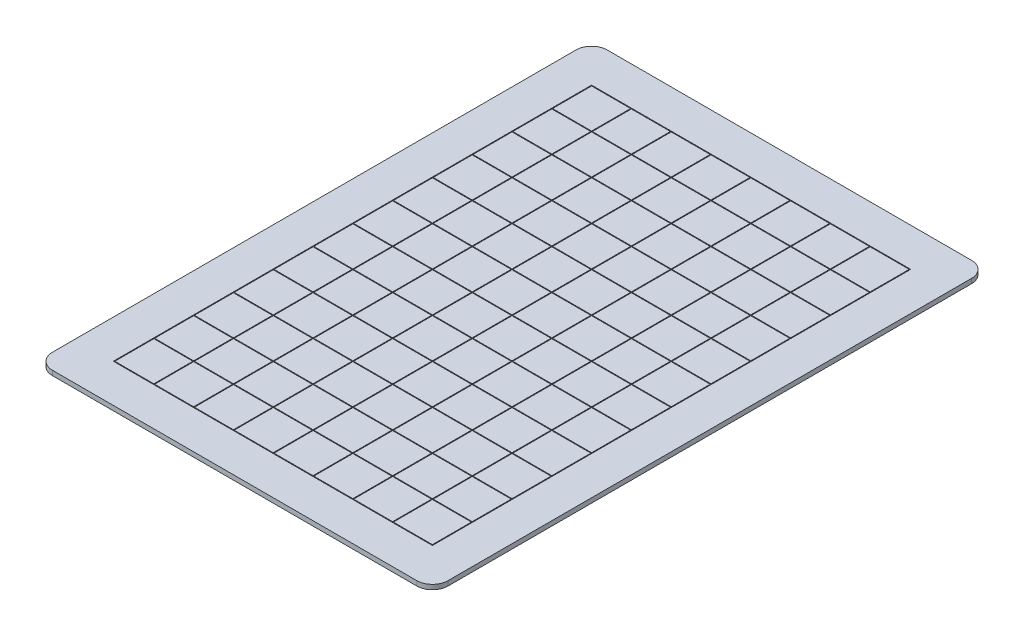
from build123d import *

# Parameters (mm, degrees)
SKETCH1_W           = 253.5
SKETCH1_H           = 355.5
BOSS_EXTRUDE1_DEPTH = 3
SKETCH2_W           = 204.5
SKETCH2_H           = 306.5
SKETCH2_W_2         = 25
SKETCH2_H_2         = 25
CUT_EXTRUDE1_DEPTH  = 0.5
SKETCH4_R           = 1.6
CUT_EXTRUDE2_DEPTH  = 1.2
FILLET1_R           = 10
SKETCH5_W           = 5
SKETCH5_H           = 4
SKETCH5_H_2         = 4.38
CUT_EXTRUDE3_DEPTH  = 2
SKETCH5_3_W         = 5
SKETCH5_3_H         = 4
SKETCH5_3_H_2       = 4.38
CUT_EXTRUDE4_DEPTH  = 2


with BuildPart() as part:
    # Sketch1 → Boss-Extrude1 (new body)
    with BuildSketch(Plane(origin=(0, 0, 0), x_dir=(1, 0, 0), z_dir=(0, 1, 0))):
        with Locations((126.75, 177.75)):
            Rectangle(SKETCH1_W, SKETCH1_H)
    extrude(amount=BOSS_EXTRUDE1_DEPTH)

    # Sketch2 → Cut-Extrude1 (cut)
    with BuildSketch(Plane(origin=(0, 3, 0), x_dir=(1, 0, 0), z_dir=(0, 1, 0))):
        with Locations((126.75, 177.75)):
            Rectangle(SKETCH2_W, SKETCH2_H)
        with Locations((37.5, 37.5)):
            Rectangle(SKETCH2_W_2, SKETCH2_H_2, mode=Mode.SUBTRACT)
        with Locations((63, 37.5)):
            Rectangle(SKETCH2_W_2, SKETCH2_H_2, mode=Mode.SUBTRACT)
        with Locations((88.5, 37.5)):
            Rectangle(SKETCH2_W_2, SKETCH2_H_2, mode=Mode.SUBTRACT)
        with Locations((114, 37.5)):
            Rectangle(SKETCH2_W_2, SKETCH2_H_2, mode=Mode.SUBTRACT)
        with Locations((139.5, 37.5)):
            Rectangle(SKETCH2_W_2, SKETCH2_H_2, mode=Mode.SUBTRACT)
        with Locations((165, 37.5)):
            Rectangle(SKETCH2_W_2, SKETCH2_H_2, mode=Mode.SUBTRACT)
        with Locations((190.5, 37.5)):
            Rectangle(SKETCH2_W_2, SKETCH2_H_2, mode=Mode.SUBTRACT)
        with Locations((216, 37.5)):
            Rectangle(SKETCH2_W_2, SKETCH2_H_2, mode=Mode.SUBTRACT)
        with Locations((63, 63)):
            Rectangle(SKETCH2_W_2, SKETCH2_H_2, mode=Mode.SUBTRACT)
        with Locations((88.5, 63)):
            Rectangle(SKETCH2_W_2, SKETCH2_H_2, mode=Mode.SUBTRACT)
        with Locations((114, 63)):
            Rectangle(SKETCH2_W_2, SKETCH2_H_2, mode=Mode.SUBTRACT)
        with Locations((139.5, 63)):
            Rectangle(SKETCH2_W_2, SKETCH2_H_2, mode=Mode.SUBTRACT)
        with Locations((165, 63)):
            Rectangle(SKETCH2_W_2, SKETCH2_H_2, mode=Mode.SUBTRACT)
        with Locations((190.5, 63)):
            Rectangle(SKETCH2_W_2, SKETCH2_H_2, mode=Mode.SUBTRACT)
        with Locations((216, 63)):
            Rectangle(SKETCH2_W_2, SKETCH2_H_2, mode=Mode.SUBTRACT)
        with Locations((63, 88.5)):
            Rectangle(SKETCH2_W_2, SKETCH2_H_2, mode=Mode.SUBTRACT)
        with Locations((88.5, 88.5)):
            Rectangle(SKETCH2_W_2, SKETCH2_H_2, mode=Mode.SUBTRACT)
        with Locations((114, 88.5)):
            Rectangle(SKETCH2_W_2, SKETCH2_H_2, mode=Mode.SUBTRACT)
        with Locations((139.5, 88.5)):
            Rectangle(SKETCH2_W_2, SKETCH2_H_2, mode=Mode.SUBTRACT)
        with Locations((165, 88.5)):
            Rectangle(SKETCH2_W_2, SKETCH2_H_2, mode=Mode.SUBTRACT)
        with Locations((190.5, 88.5)):
            Rectangle(SKETCH2_W_2, SKETCH2_H_2, mode=Mode.SUBTRACT)
        with Locations((216, 88.5)):
            Rectangle(SKETCH2_W_2, SKETCH2_H_2, mode=Mode.SUBTRACT)
        with Locations((63, 114)):
            Rectangle(SKETCH2_W_2, SKETCH2_H_2, mode=Mode.SUBTRACT)
        with Locations((88.5, 114)):
            Rectangle(SKETCH2_W_2, SKETCH2_H_2, mode=Mode.SUBTRACT)
        with Locations((114, 114)):
            Rectangle(SKETCH2_W_2, SKETCH2_H_2, mode=Mode.SUBTRACT)
        with Locations((139.5, 114)):
            Rectangle(SKETCH2_W_2, SKETCH2_H_2, mode=Mode.SUBTRACT)
        with Locations((165, 114)):
            Rectangle(SKETCH2_W_2, SKETCH2_H_2, mode=Mode.SUBTRACT)
        with Locations((190.5, 114)):
            Rectangle(SKETCH2_W_2, SKETCH2_H_2, mode=Mode.SUBTRACT)
        with Locations((216, 114)):
            Rectangle(SKETCH2_W_2, SKETCH2_H_2, mode=Mode.SUBTRACT)
        with Locations((63, 139.5)):
            Rectangle(SKETCH2_W_2, SKETCH2_H_2, mode=Mode.SUBTRACT)
        with Locations((88.5, 139.5)):
            Rectangle(SKETCH2_W_2, SKETCH2_H_2, mode=Mode.SUBTRACT)
        with Locations((114, 139.5)):
            Rectangle(SKETCH2_W_2, SKETCH2_H_2, mode=Mode.SUBTRACT)
        with Locations((139.5, 139.5)):
            Rectangle(SKETCH2_W_2, SKETCH2_H_2, mode=Mode.SUBTRACT)
        with Locations((165, 139.5)):
            Rectangle(SKETCH2_W_2, SKETCH2_H_2, mode=Mode.SUBTRACT)
        with Locations((190.5, 139.5)):
            Rectangle(SKETCH2_W_2, SKETCH2_H_2, mode=Mode.SUBTRACT)
        with Locations((216, 139.5)):
            Rectangle(SKETCH2_W_2, SKETCH2_H_2, mode=Mode.SUBTRACT)
        with Locations((63, 165)):
            Rectangle(SKETCH2_W_2, SKETCH2_H_2, mode=Mode.SUBTRACT)
        with Locations((88.5, 165)):
            Rectangle(SKETCH2_W_2, SKETCH2_H_2, mode=Mode.SUBTRACT)
        with Locations((114, 165)):
            Rectangle(SKETCH2_W_2, SKETCH2_H_2, mode=Mode.SUBTRACT)
        with Locations((139.5, 165)):
            Rectangle(SKETCH2_W_2, SKETCH2_H_2, mode=Mode.SUBTRACT)
        with Locations((165, 165)):
            Rectangle(SKETCH2_W_2, SKETCH2_H_2, mode=Mode.SUBTRACT)
        with Locations((190.5, 165)):
            Rectangle(SKETCH2_W_2, SKETCH2_H_2, mode=Mode.SUBTRACT)
        with Locations((216, 165)):
            Rectangle(SKETCH2_W_2, SKETCH2_H_2, mode=Mode.SUBTRACT)
        with Locations((63, 190.5)):
            Rectangle(SKETCH2_W_2, SKETCH2_H_2, mode=Mode.SUBTRACT)
        with Locations((88.5, 190.5)):
            Rectangle(SKETCH2_W_2, SKETCH2_H_2, mode=Mode.SUBTRACT)
        with Locations((114, 190.5)):
            Rectangle(SKETCH2_W_2, SKETCH2_H_2, mode=Mode.SUBTRACT)
        with Locations((139.5, 190.5)):
            Rectangle(SKETCH2_W_2, SKETCH2_H_2, mode=Mode.SUBTRACT)
        with Locations((165, 190.5)):
            Rectangle(SKETCH2_W_2, SKETCH2_H_2, mode=Mode.SUBTRACT)
        with Locations((190.5, 190.5)):
            Rectangle(SKETCH2_W_2, SKETCH2_H_2, mode=Mode.SUBTRACT)
        with Locations((216, 190.5)):
            Rectangle(SKETCH2_W_2, SKETCH2_H_2, mode=Mode.SUBTRACT)
        with Locations((63, 216)):
            Rectangle(SKETCH2_W_2, SKETCH2_H_2, mode=Mode.SUBTRACT)
        with Locations((88.5, 216)):
            Rectangle(SKETCH2_W_2, SKETCH2_H_2, mode=Mode.SUBTRACT)
        with Locations((114, 216)):
            Rectangle(SKETCH2_W_2, SKETCH2_H_2, mode=Mode.SUBTRACT)
        with Locations((139.5, 216)):
            Rectangle(SKETCH2_W_2, SKETCH2_H_2, mode=Mode.SUBTRACT)
        with Locations((165, 216)):
            Rectangle(SKETCH2_W_2, SKETCH2_H_2, mode=Mode.SUBTRACT)
        with Locations((190.5, 216)):
            Rectangle(SKETCH2_W_2, SKETCH2_H_2, mode=Mode.SUBTRACT)
        with Locations((216, 216)):
            Rectangle(SKETCH2_W_2, SKETCH2_H_2, mode=Mode.SUBTRACT)
        with Locations((63, 241.5)):
            Rectangle(SKETCH2_W_2, SKETCH2_H_2, mode=Mode.SUBTRACT)
        with Locations((88.5, 241.5)):
            Rectangle(SKETCH2_W_2, SKETCH2_H_2, mode=Mode.SUBTRACT)
        with Locations((114, 241.5)):
            Rectangle(SKETCH2_W_2, SKETCH2_H_2, mode=Mode.SUBTRACT)
        with Locations((139.5, 241.5)):
            Rectangle(SKETCH2_W_2, SKETCH2_H_2, mode=Mode.SUBTRACT)
        with Locations((165, 241.5)):
            Rectangle(SKETCH2_W_2, SKETCH2_H_2, mode=Mode.SUBTRACT)
        with Locations((190.5, 241.5)):
            Rectangle(SKETCH2_W_2, SKETCH2_H_2, mode=Mode.SUBTRACT)
        with Locations((216, 241.5)):
            Rectangle(SKETCH2_W_2, SKETCH2_H_2, mode=Mode.SUBTRACT)
        with Locations((63, 267)):
            Rectangle(SKETCH2_W_2, SKETCH2_H_2, mode=Mode.SUBTRACT)
        with Locations((88.5, 267)):
            Rectangle(SKETCH2_W_2, SKETCH2_H_2, mode=Mode.SUBTRACT)
        with Locations((114, 267)):
            Rectangle(SKETCH2_W_2, SKETCH2_H_2, mode=Mode.SUBTRACT)
        with Locations((139.5, 267)):
            Rectangle(SKETCH2_W_2, SKETCH2_H_2, mode=Mode.SUBTRACT)
        with Locations((165, 267)):
            Rectangle(SKETCH2_W_2, SKETCH2_H_2, mode=Mode.SUBTRACT)
        with Locations((190.5, 267)):
            Rectangle(SKETCH2_W_2, SKETCH2_H_2, mode=Mode.SUBTRACT)
        with Locations((216, 267)):
            Rectangle(SKETCH2_W_2, SKETCH2_H_2, mode=Mode.SUBTRACT)
        with Locations((63, 292.5)):
            Rectangle(SKETCH2_W_2, SKETCH2_H_2, mode=Mode.SUBTRACT)
        with Locations((88.5, 292.5)):
            Rectangle(SKETCH2_W_2, SKETCH2_H_2, mode=Mode.SUBTRACT)
        with Locations((114, 292.5)):
            Rectangle(SKETCH2_W_2, SKETCH2_H_2, mode=Mode.SUBTRACT)
        with Locations((139.5, 292.5)):
            Rectangle(SKETCH2_W_2, SKETCH2_H_2, mode=Mode.SUBTRACT)
        with Locations((165, 292.5)):
            Rectangle(SKETCH2_W_2, SKETCH2_H_2, mode=Mode.SUBTRACT)
        with Locations((190.5, 292.5)):
            Rectangle(SKETCH2_W_2, SKETCH2_H_2, mode=Mode.SUBTRACT)
        with Locations((216, 292.5)):
            Rectangle(SKETCH2_W_2, SKETCH2_H_2, mode=Mode.SUBTRACT)
        with Locations((63, 318)):
            Rectangle(SKETCH2_W_2, SKETCH2_H_2, mode=Mode.SUBTRACT)
        with Locations((88.5, 318)):
            Rectangle(SKETCH2_W_2, SKETCH2_H_2, mode=Mode.SUBTRACT)
        with Locations((114, 318)):
            Rectangle(SKETCH2_W_2, SKETCH2_H_2, mode=Mode.SUBTRACT)
        with Locations((139.5, 318)):
            Rectangle(SKETCH2_W_2, SKETCH2_H_2, mode=Mode.SUBTRACT)
        with Locations((165, 318)):
            Rectangle(SKETCH2_W_2, SKETCH2_H_2, mode=Mode.SUBTRACT)
        with Locations((190.5, 318)):
            Rectangle(SKETCH2_W_2, SKETCH2_H_2, mode=Mode.SUBTRACT)
        with Locations((216, 318)):
            Rectangle(SKETCH2_W_2, SKETCH2_H_2, mode=Mode.SUBTRACT)
        with Locations((37.5, 63)):
            Rectangle(SKETCH2_W_2, SKETCH2_H_2, mode=Mode.SUBTRACT)
        with Locations((37.5, 88.5)):
            Rectangle(SKETCH2_W_2, SKETCH2_H_2, mode=Mode.SUBTRACT)
        with Locations((37.5, 114)):
            Rectangle(SKETCH2_W_2, SKETCH2_H_2, mode=Mode.SUBTRACT)
        with Locations((37.5, 139.5)):
            Rectangle(SKETCH2_W_2, SKETCH2_H_2, mode=Mode.SUBTRACT)
        with Locations((37.5, 165)):
            Rectangle(SKETCH2_W_2, SKETCH2_H_2, mode=Mode.SUBTRACT)
        with Locations((37.5, 190.5)):
            Rectangle(SKETCH2_W_2, SKETCH2_H_2, mode=Mode.SUBTRACT)
        with Locations((37.5, 216)):
            Rectangle(SKETCH2_W_2, SKETCH2_H_2, mode=Mode.SUBTRACT)
        with Locations((37.5, 241.5)):
            Rectangle(SKETCH2_W_2, SKETCH2_H_2, mode=Mode.SUBTRACT)
        with Locations((37.5, 267)):
            Rectangle(SKETCH2_W_2, SKETCH2_H_2, mode=Mode.SUBTRACT)
        with Locations((37.5, 292.5)):
            Rectangle(SKETCH2_W_2, SKETCH2_H_2, mode=Mode.SUBTRACT)
        with Locations((37.5, 318)):
            Rectangle(SKETCH2_W_2, SKETCH2_H_2, mode=Mode.SUBTRACT)
    extrude(amount=-CUT_EXTRUDE1_DEPTH, mode=Mode.SUBTRACT)

    # Sketch4 → Cut-Extrude2 (cut)
    with BuildSketch(Plane.XZ):
        with Locations((6, -177.75)):
            Circle(SKETCH4_R)
        with Locations((247.5, -177.75)):
            Circle(SKETCH4_R)
        with Locations((6, -6)):
            Circle(SKETCH4_R)
        with Locations((6, -91.875)):
            Circle(SKETCH4_R)
        with Locations((6, -263.625)):
            Circle(SKETCH4_R)
        with Locations((6, -349.5)):
            Circle(SKETCH4_R)
        with Locations((247.5, -6)):
            Circle(SKETCH4_R)
        with Locations((247.5, -91.875)):
            Circle(SKETCH4_R)
        with Locations((247.5, -263.625)):
            Circle(SKETCH4_R)
        with Locations((86.5, -349.5)):
            Circle(SKETCH4_R)
        with Locations((167, -349.5)):
            Circle(SKETCH4_R)
        with Locations((247.5, -349.5)):
            Circle(SKETCH4_R)
        with Locations((167, -6)):
            Circle(SKETCH4_R)
        with Locations((86.5, -6)):
            Circle(SKETCH4_R)
    extrude(amount=-CUT_EXTRUDE2_DEPTH, mode=Mode.SUBTRACT)

    # Fillet1
    fillet1_edges = [part.edges().sort_by_distance(p)[0] for p in [
        (253.5, 1.5, 0),
        (0, 1.5, 0),
        (0, 1.5, -355.5),
        (253.5, 1.5, -355.5),
    ]]
    fillet(fillet1_edges, radius=FILLET1_R)

    # Sketch5 → Cut-Extrude3 (cut)
    with BuildSketch(Plane.XZ):
        with Locations((190.5, -241.5)):
            Rectangle(SKETCH5_W, SKETCH5_H)
        with Locations((190.5, -247.69)):
            Rectangle(SKETCH5_W, SKETCH5_H_2)
        with Locations((190.5, -216)):
            Rectangle(SKETCH5_W, SKETCH5_H)
        with Locations((190.5, -222.19)):
            Rectangle(SKETCH5_W, SKETCH5_H_2)
        with Locations((165, -216)):
            Rectangle(SKETCH5_W, SKETCH5_H)
        with Locations((165, -222.19)):
            Rectangle(SKETCH5_W, SKETCH5_H_2)
        with Locations((139.5, -216)):
            Rectangle(SKETCH5_W, SKETCH5_H)
        with Locations((139.5, -222.19)):
            Rectangle(SKETCH5_W, SKETCH5_H_2)
        with Locations((114, -216)):
            Rectangle(SKETCH5_W, SKETCH5_H)
        with Locations((114, -222.19)):
            Rectangle(SKETCH5_W, SKETCH5_H_2)
        with Locations((88.5, -216)):
            Rectangle(SKETCH5_W, SKETCH5_H)
        with Locations((88.5, -222.19)):
            Rectangle(SKETCH5_W, SKETCH5_H_2)
        with Locations((63, -216)):
            Rectangle(SKETCH5_W, SKETCH5_H)
        with Locations((63, -222.19)):
            Rectangle(SKETCH5_W, SKETCH5_H_2)
        with Locations((37.5, -216)):
            Rectangle(SKETCH5_W, SKETCH5_H)
        with Locations((37.5, -222.19)):
            Rectangle(SKETCH5_W, SKETCH5_H_2)
        with Locations((190.5, -190.5)):
            Rectangle(SKETCH5_W, SKETCH5_H)
        with Locations((190.5, -196.69)):
            Rectangle(SKETCH5_W, SKETCH5_H_2)
        with Locations((165, -190.5)):
            Rectangle(SKETCH5_W, SKETCH5_H)
        with Locations((165, -196.69)):
            Rectangle(SKETCH5_W, SKETCH5_H_2)
        with Locations((139.5, -190.5)):
            Rectangle(SKETCH5_W, SKETCH5_H)
        with Locations((139.5, -196.69)):
            Rectangle(SKETCH5_W, SKETCH5_H_2)
        with Locations((114, -190.5)):
            Rectangle(SKETCH5_W, SKETCH5_H)
        with Locations((114, -196.69)):
            Rectangle(SKETCH5_W, SKETCH5_H_2)
        with Locations((88.5, -190.5)):
            Rectangle(SKETCH5_W, SKETCH5_H)
        with Locations((88.5, -196.69)):
            Rectangle(SKETCH5_W, SKETCH5_H_2)
        with Locations((63, -190.5)):
            Rectangle(SKETCH5_W, SKETCH5_H)
        with Locations((63, -196.69)):
            Rectangle(SKETCH5_W, SKETCH5_H_2)
        with Locations((37.5, -190.5)):
            Rectangle(SKETCH5_W, SKETCH5_H)
        with Locations((37.5, -196.69)):
            Rectangle(SKETCH5_W, SKETCH5_H_2)
        with Locations((190.5, -165)):
            Rectangle(SKETCH5_W, SKETCH5_H)
        with Locations((190.5, -171.19)):
            Rectangle(SKETCH5_W, SKETCH5_H_2)
        with Locations((165, -165)):
            Rectangle(SKETCH5_W, SKETCH5_H)
        with Locations((165, -171.19)):
            Rectangle(SKETCH5_W, SKETCH5_H_2)
        with Locations((139.5, -165)):
            Rectangle(SKETCH5_W, SKETCH5_H)
        with Locations((139.5, -171.19)):
            Rectangle(SKETCH5_W, SKETCH5_H_2)
        with Locations((114, -165)):
            Rectangle(SKETCH5_W, SKETCH5_H)
        with Locations((114, -171.19)):
            Rectangle(SKETCH5_W, SKETCH5_H_2)
        with Locations((88.5, -165)):
            Rectangle(SKETCH5_W, SKETCH5_H)
        with Locations((88.5, -171.19)):
            Rectangle(SKETCH5_W, SKETCH5_H_2)
        with Locations((63, -165)):
            Rectangle(SKETCH5_W, SKETCH5_H)
        with Locations((63, -171.19)):
            Rectangle(SKETCH5_W, SKETCH5_H_2)
        with Locations((37.5, -165)):
            Rectangle(SKETCH5_W, SKETCH5_H)
        with Locations((37.5, -171.19)):
            Rectangle(SKETCH5_W, SKETCH5_H_2)
        with Locations((190.5, -139.5)):
            Rectangle(SKETCH5_W, SKETCH5_H)
        with Locations((190.5, -145.69)):
            Rectangle(SKETCH5_W, SKETCH5_H_2)
        with Locations((165, -139.5)):
            Rectangle(SKETCH5_W, SKETCH5_H)
        with Locations((165, -145.69)):
            Rectangle(SKETCH5_W, SKETCH5_H_2)
        with Locations((139.5, -139.5)):
            Rectangle(SKETCH5_W, SKETCH5_H)
        with Locations((139.5, -145.69)):
            Rectangle(SKETCH5_W, SKETCH5_H_2)
        with Locations((114, -139.5)):
            Rectangle(SKETCH5_W, SKETCH5_H)
        with Locations((114, -145.69)):
            Rectangle(SKETCH5_W, SKETCH5_H_2)
        with Locations((88.5, -139.5)):
            Rectangle(SKETCH5_W, SKETCH5_H)
        with Locations((88.5, -145.69)):
            Rectangle(SKETCH5_W, SKETCH5_H_2)
        with Locations((63, -139.5)):
            Rectangle(SKETCH5_W, SKETCH5_H)
        with Locations((63, -145.69)):
            Rectangle(SKETCH5_W, SKETCH5_H_2)
        with Locations((37.5, -139.5)):
            Rectangle(SKETCH5_W, SKETCH5_H)
        with Locations((37.5, -145.69)):
            Rectangle(SKETCH5_W, SKETCH5_H_2)
        with Locations((190.5, -114)):
            Rectangle(SKETCH5_W, SKETCH5_H)
        with Locations((190.5, -120.19)):
            Rectangle(SKETCH5_W, SKETCH5_H_2)
        with Locations((165, -114)):
            Rectangle(SKETCH5_W, SKETCH5_H)
        with Locations((165, -120.19)):
            Rectangle(SKETCH5_W, SKETCH5_H_2)
        with Locations((139.5, -114)):
            Rectangle(SKETCH5_W, SKETCH5_H)
        with Locations((139.5, -120.19)):
            Rectangle(SKETCH5_W, SKETCH5_H_2)
        with Locations((114, -114)):
            Rectangle(SKETCH5_W, SKETCH5_H)
        with Locations((114, -120.19)):
            Rectangle(SKETCH5_W, SKETCH5_H_2)
        with Locations((88.5, -114)):
            Rectangle(SKETCH5_W, SKETCH5_H)
        with Locations((88.5, -120.19)):
            Rectangle(SKETCH5_W, SKETCH5_H_2)
        with Locations((63, -114)):
            Rectangle(SKETCH5_W, SKETCH5_H)
        with Locations((63, -120.19)):
            Rectangle(SKETCH5_W, SKETCH5_H_2)
        with Locations((37.5, -114)):
            Rectangle(SKETCH5_W, SKETCH5_H)
        with Locations((37.5, -120.19)):
            Rectangle(SKETCH5_W, SKETCH5_H_2)
        with Locations((190.5, -88.5)):
            Rectangle(SKETCH5_W, SKETCH5_H)
        with Locations((190.5, -94.69)):
            Rectangle(SKETCH5_W, SKETCH5_H_2)
        with Locations((165, -88.5)):
            Rectangle(SKETCH5_W, SKETCH5_H)
        with Locations((165, -94.69)):
            Rectangle(SKETCH5_W, SKETCH5_H_2)
        with Locations((139.5, -88.5)):
            Rectangle(SKETCH5_W, SKETCH5_H)
        with Locations((139.5, -94.69)):
            Rectangle(SKETCH5_W, SKETCH5_H_2)
        with Locations((114, -88.5)):
            Rectangle(SKETCH5_W, SKETCH5_H)
        with Locations((114, -94.69)):
            Rectangle(SKETCH5_W, SKETCH5_H_2)
        with Locations((88.5, -88.5)):
            Rectangle(SKETCH5_W, SKETCH5_H)
        with Locations((88.5, -94.69)):
            Rectangle(SKETCH5_W, SKETCH5_H_2)
        with Locations((63, -88.5)):
            Rectangle(SKETCH5_W, SKETCH5_H)
        with Locations((63, -94.69)):
            Rectangle(SKETCH5_W, SKETCH5_H_2)
        with Locations((37.5, -88.5)):
            Rectangle(SKETCH5_W, SKETCH5_H)
        with Locations((37.5, -94.69)):
            Rectangle(SKETCH5_W, SKETCH5_H_2)
        with Locations((216, -241.5)):
            Rectangle(SKETCH5_W, SKETCH5_H)
        with Locations((216, -247.69)):
            Rectangle(SKETCH5_W, SKETCH5_H_2)
        with Locations((216, -216)):
            Rectangle(SKETCH5_W, SKETCH5_H)
        with Locations((216, -222.19)):
            Rectangle(SKETCH5_W, SKETCH5_H_2)
        with Locations((216, -190.5)):
            Rectangle(SKETCH5_W, SKETCH5_H)
        with Locations((216, -196.69)):
            Rectangle(SKETCH5_W, SKETCH5_H_2)
        with Locations((216, -165)):
            Rectangle(SKETCH5_W, SKETCH5_H)
        with Locations((216, -171.19)):
            Rectangle(SKETCH5_W, SKETCH5_H_2)
        with Locations((216, -139.5)):
            Rectangle(SKETCH5_W, SKETCH5_H)
        with Locations((216, -145.69)):
            Rectangle(SKETCH5_W, SKETCH5_H_2)
        with Locations((216, -114)):
            Rectangle(SKETCH5_W, SKETCH5_H)
        with Locations((216, -120.19)):
            Rectangle(SKETCH5_W, SKETCH5_H_2)
        with Locations((216, -88.5)):
            Rectangle(SKETCH5_W, SKETCH5_H)
        with Locations((216, -94.69)):
            Rectangle(SKETCH5_W, SKETCH5_H_2)
    extrude(amount=-CUT_EXTRUDE3_DEPTH, mode=Mode.SUBTRACT)

    # Sketch5<3> → Cut-Extrude4 (cut)
    with BuildSketch(Plane.XZ):
        with Locations((216, -267)):
            Rectangle(SKETCH5_3_W, SKETCH5_3_H)
        with Locations((216, -273.19)):
            Rectangle(SKETCH5_3_W, SKETCH5_3_H_2)
        with Locations((190.5, -267)):
            Rectangle(SKETCH5_3_W, SKETCH5_3_H)
        with Locations((190.5, -273.19)):
            Rectangle(SKETCH5_3_W, SKETCH5_3_H_2)
        with Locations((165, -267)):
            Rectangle(SKETCH5_3_W, SKETCH5_3_H)
        with Locations((165, -273.19)):
            Rectangle(SKETCH5_3_W, SKETCH5_3_H_2)
        with Locations((139.5, -267)):
            Rectangle(SKETCH5_3_W, SKETCH5_3_H)
        with Locations((139.5, -273.19)):
            Rectangle(SKETCH5_3_W, SKETCH5_3_H_2)
        with Locations((114, -267)):
            Rectangle(SKETCH5_3_W, SKETCH5_3_H)
        with Locations((114, -273.19)):
            Rectangle(SKETCH5_3_W, SKETCH5_3_H_2)
        with Locations((88.5, -267)):
            Rectangle(SKETCH5_3_W, SKETCH5_3_H)
        with Locations((88.5, -273.19)):
            Rectangle(SKETCH5_3_W, SKETCH5_3_H_2)
        with Locations((63, -267)):
            Rectangle(SKETCH5_3_W, SKETCH5_3_H)
        with Locations((63, -273.19)):
            Rectangle(SKETCH5_3_W, SKETCH5_3_H_2)
        with Locations((37.5, -267)):
            Rectangle(SKETCH5_3_W, SKETCH5_3_H)
        with Locations((37.5, -273.19)):
            Rectangle(SKETCH5_3_W, SKETCH5_3_H_2)
        with Locations((165, -241.5)):
            Rectangle(SKETCH5_3_W, SKETCH5_3_H)
        with Locations((165, -247.69)):
            Rectangle(SKETCH5_3_W, SKETCH5_3_H_2)
        with Locations((139.5, -241.5)):
            Rectangle(SKETCH5_3_W, SKETCH5_3_H)
        with Locations((139.5, -247.69)):
            Rectangle(SKETCH5_3_W, SKETCH5_3_H_2)
        with Locations((114, -241.5)):
            Rectangle(SKETCH5_3_W, SKETCH5_3_H)
        with Locations((114, -247.69)):
            Rectangle(SKETCH5_3_W, SKETCH5_3_H_2)
        with Locations((88.5, -241.5)):
            Rectangle(SKETCH5_3_W, SKETCH5_3_H)
        with Locations((88.5, -247.69)):
            Rectangle(SKETCH5_3_W, SKETCH5_3_H_2)
        with Locations((63, -241.5)):
            Rectangle(SKETCH5_3_W, SKETCH5_3_H)
        with Locations((63, -247.69)):
            Rectangle(SKETCH5_3_W, SKETCH5_3_H_2)
        with Locations((37.5, -241.5)):
            Rectangle(SKETCH5_3_W, SKETCH5_3_H)
        with Locations((37.5, -247.69)):
            Rectangle(SKETCH5_3_W, SKETCH5_3_H_2)
    extrude(amount=-CUT_EXTRUDE4_DEPTH, mode=Mode.SUBTRACT)


solid = part.part
